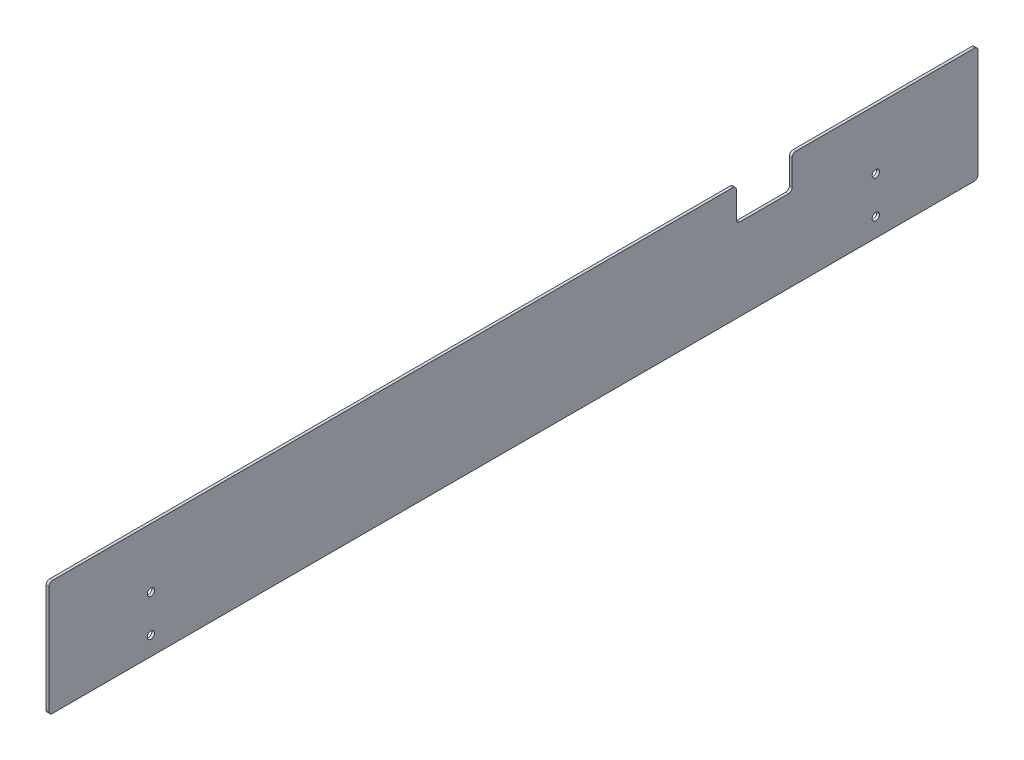
from build123d import *

# Parameters (mm, degrees)
BOSS_EXTRUDE1_DEPTH = 1.5
FILLET1_R           = 2
SKETCH2_R           = 1.95
CUT_EXTRUDE1_DEPTH  = 10


with BuildPart() as part:
    # Sketch1 → Boss-Extrude1 (new body)
    with BuildSketch(Plane(origin=(0, 0, 0), x_dir=(0, 0, -1), z_dir=(1, 0, 0))):
        Polygon((130.053191489, -78.292553191), (230.053191489, -78.292553191), (230.053191489, -140.292553191), (-269.946808511, -140.292553191), (-269.946808511, -78.292553191), (100.053191489, -78.292553191), (100.053191489, -96.149126431), (130.053191489, -96.149126431), align=None)
    extrude(amount=BOSS_EXTRUDE1_DEPTH)

    # Fillet1
    fillet1_edges = [part.edges().sort_by_distance(p)[0] for p in [
        (0.75, -140.292553191, -230.053191489),
        (0.75, -140.292553191, 269.946808511),
        (0.75, -78.292553191, 269.946808511),
        (0.75, -78.292553191, -100.053191489),
        (0.75, -96.149126431, -100.053191489),
        (0.75, -96.149126431, -130.053191489),
        (0.75, -78.292553191, -130.053191489),
        (0.75, -78.292553191, -230.053191489),
    ]]
    fillet(fillet1_edges, radius=FILLET1_R)

    # Sketch2 → Cut-Extrude1 (cut)
    with BuildSketch(Plane.ZY):
        with Locations((-175.053191489, -110.292553191)):
            Circle(SKETCH2_R)
        with Locations((-175.053191489, -130.292553191)):
            Circle(SKETCH2_R)
        with Locations((214.946808511, -110.292553191)):
            Circle(SKETCH2_R)
        with Locations((214.946808511, -130.292553191)):
            Circle(SKETCH2_R)
    extrude(amount=-CUT_EXTRUDE1_DEPTH, mode=Mode.SUBTRACT)


solid = part.part
